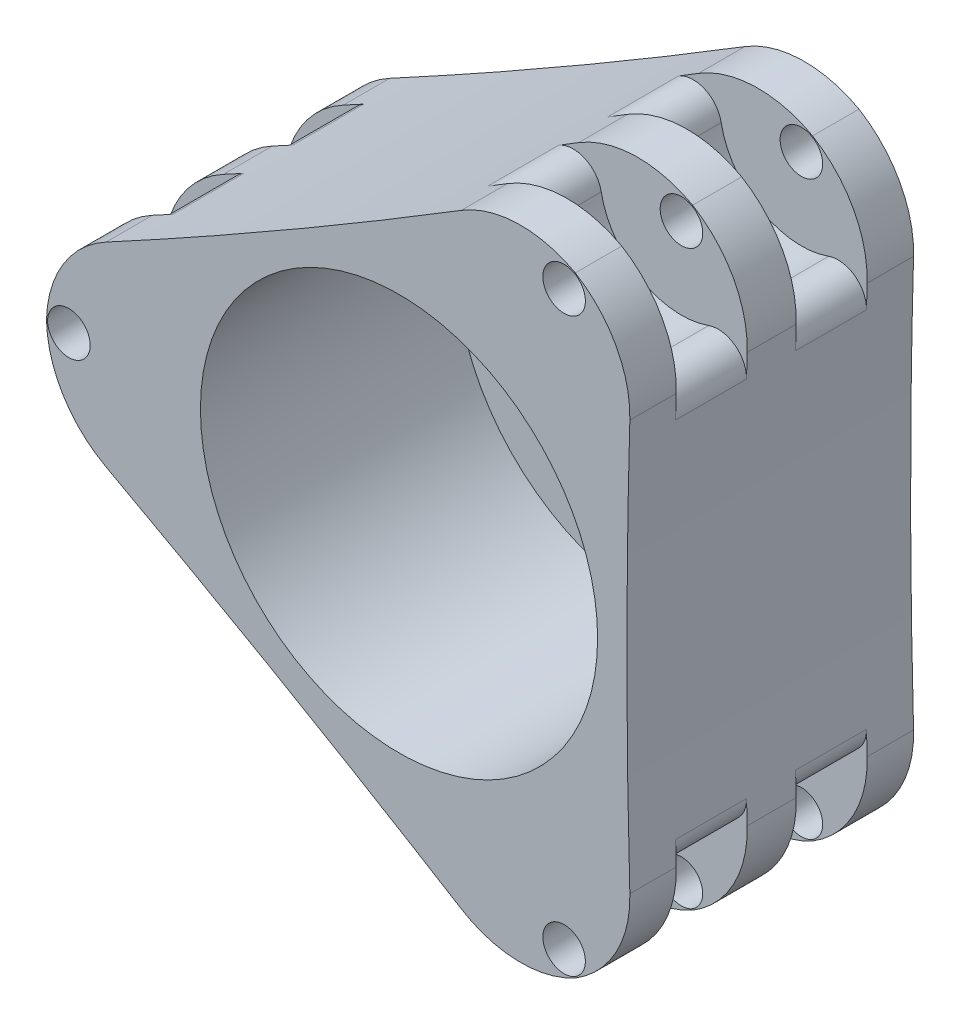
from build123d import *

# Parameters (mm, degrees)
BOSS_EXTRUDE1_DEPTH     = 20
SKETCH4_R               = 14
CUT_EXTRUDE3_DEPTH      = 18
CUT_EXTRUDE4_DEPTH      = 39.683044831
CUT_EXTRUDE4_DEPTH_BACK = 39.683044831
SKETCH5_R               = 5
FILLET2_R               = 8
CIRPATTERN2_DEPTH       = 20
SKETCH2_R               = 1.5
CUT_EXTRUDE1_DEPTH      = 40.044088383
CIRPATTERN10_COUNT      = 3
SKETCH3_R               = 5.75
CUT_EXTRUDE2_DEPTH      = 2.5
CIRPATTERN3_COUNT       = 3
FILLET3_R               = 2
MIRROR1_START           = 11.728432102
MIRROR1_OUTLINE_R       = 1.5
MIRROR1_DEPTH           = 5


# Read off the part's stored shape, not the designer's step: CirPattern2, Mirror1
with BuildPart() as part:
    # Sketch1 → Boss-Extrude1 (new body)
    with BuildSketch(Plane.XY):
        with BuildLine():
            ThreePointArc((-24.374188266, 4.877682355), (-24.857450368, 0), (-24.374188266, -4.877682355))
            add(Edge.make_bspline(
                [(7.962897302, -23.547507412), (-7.857485411, -13.609563951), (-24.374188266, -4.877682355)],
                knots=[0, 0, 0, 1, 1, 1], degree=2))
            ThreePointArc((7.962897302, -23.547507412), (12.428725184, -21.527183492), (16.411290964, -18.669825058))
            add(Edge.make_bspline(
                [(16.411290964, 18.669825058), (15.714970822, 0), (16.411290964, -18.669825058)],
                knots=[0, 0, 0, 1, 1, 1], degree=2))
            ThreePointArc((16.411290964, 18.669825058), (12.428725184, 21.527183492), (7.962897302, 23.547507412))
            add(Edge.make_bspline(
                [(-24.374188266, 4.877682355), (-7.857485411, 13.609563951), (7.962897302, 23.547507412)],
                knots=[0, 0, 0, 1, 1, 1], degree=2))
        make_face()
    extrude(amount=BOSS_EXTRUDE1_DEPTH)

    # Sketch4 → Cut-Extrude3 (cut)
    with BuildSketch(Plane.XY.offset(20)):
        Circle(SKETCH4_R)
    extrude(amount=-CUT_EXTRUDE3_DEPTH, mode=Mode.SUBTRACT)

    # Sketch5 → Cut-Extrude4 (cut, two sides: drawn at the far end of the back side and taken through both)
    with BuildSketch(Plane.XY.offset(2).offset(-CUT_EXTRUDE4_DEPTH_BACK)):
        Circle(SKETCH5_R)
    extrude(amount=CUT_EXTRUDE4_DEPTH + CUT_EXTRUDE4_DEPTH_BACK, mode=Mode.SUBTRACT)

    # Fillet2
    # the kernel refuses this fillet: 8 mm, written as the material it takes off along each edge
    with BuildSketch(Plane(origin=(-24.374188266, -4.877682355, -12.902163969), x_dir=(-0.09337496736268357, 0.9956310137144271, 0), z_dir=(0, 0, 1))) as fillet2_piece_1:
        with BuildLine():
            CenterArc((4.330391744, -7.956777815), FILLET2_R, 84.041434424, 62.254890411)
            ThreePointArc((-2.324956501, -3.517595487), (-1.158780615, -1.761241696), (0, 0))
            ThreePointArc((0, 0), (2.580432794, 0.134299165), (5.160865588, 0))
        make_face()
    extrude(amount=45.804327938, mode=Mode.SUBTRACT)
    with BuildSketch(Plane(origin=(-24.374188266, 4.877682355, -12.902163969), x_dir=(0.8820863080273184, 0.4710878317158435, 0), z_dir=(0, 0, 1))) as fillet2_piece_2:
        with BuildLine():
            CenterArc((4.250145603, -7.999929262), FILLET2_R, 90.240945395, 62.254890411)
            ThreePointArc((-2.845672568, -4.30542463), (-1.534874647, -2.078660503), (0, 0))
            ThreePointArc((0, 0), (2.108251688, -0.004432315), (4.216503379, 0))
        make_face()
    extrude(amount=45.804327938, mode=Mode.SUBTRACT)

    # CirPattern2 outline → CirPattern2 (cut)
    with BuildSketch(Plane.XY):
        with BuildLine():
            add(Edge.make_bspline(
                [(16.411290964, -18.669825058), (16.332703446, -16.562726441), (16.27185489, -14.455627824)],
                knots=[0, 0, 0, 0.112861187, 0.112861187, 0.112861187], degree=2))
            ThreePointArc((16.27185489, -14.455627824), (15.303063117, -18.508724044), (12.427285417, -21.524689742))
            ThreePointArc((12.427285417, -21.524689742), (8.377493655, -22.507203437), (4.383013478, -21.319653613))
            add(Edge.make_bspline(
                [(4.383013478, -21.319653613), (6.17739013, -22.425899317), (7.962897302, -23.547507412)],
                knots=[0.887138813, 0.887138813, 0.887138813, 1, 1, 1], degree=2))
            ThreePointArc((7.962897302, -23.547507412), (12.428725184, -21.527183492), (16.411290964, -18.669825058))
        make_face()
        with BuildLine():
            ThreePointArc((12.427285417, 21.524689742), (15.303063117, 18.508724044), (16.271854889, 14.455627824))
            add(Edge.make_bspline(
                [(16.271854889, 14.455627824), (16.332703446, 16.562726441), (16.411290964, 18.669825058)],
                knots=[0.887138813, 0.887138813, 0.887138813, 1, 1, 1], degree=2))
            ThreePointArc((16.411290964, 18.669825058), (12.428725184, 21.527183492), (7.962897302, 23.547507412))
            add(Edge.make_bspline(
                [(7.962897302, 23.547507412), (6.17739013, 22.425899317), (4.383013478, 21.319653613)],
                knots=[0, 0, 0, 0.112861187, 0.112861187, 0.112861187], degree=2))
            ThreePointArc((4.383013478, 21.319653613), (8.377493655, 22.507203437), (12.427285417, 21.524689742))
        make_face()
    extrude(amount=CIRPATTERN2_DEPTH, mode=Mode.SUBTRACT)

    # Sketch2 → Cut-Extrude1 (cut, symmetric)
    with BuildSketch(Plane.XY.offset(20)):
        with Locations((-23.275, 0)):
            Circle(SKETCH2_R)
    cut_extrude1 = extrude(amount=CUT_EXTRUDE1_DEPTH, both=True, mode=Mode.SUBTRACT)

    # CirPattern10: Cut-Extrude1 ×3 about axis
    cirpattern10_axis = Axis((0, 0, 0), (0, 0, 1))
    for i in range(1, CIRPATTERN10_COUNT):
        add(cut_extrude1.rotate(cirpattern10_axis, i * 360 / CIRPATTERN10_COUNT), mode=Mode.SUBTRACT)

    # Sketch3 → Cut-Extrude2 (cut, symmetric)
    with BuildSketch(Plane.XY.offset(5.771567898)):
        with Locations((-23.275, 0)):
            Circle(SKETCH3_R)
    cut_extrude2 = extrude(amount=CUT_EXTRUDE2_DEPTH, both=True, mode=Mode.SUBTRACT)

    # CirPattern3: Cut-Extrude2 ×3 about axis
    cirpattern3_axis = Axis((0, 0, 0), (0, 0, 1))
    for i in range(1, CIRPATTERN3_COUNT):
        add(cut_extrude2.rotate(cirpattern3_axis, i * 360 / CIRPATTERN3_COUNT), mode=Mode.SUBTRACT)

    # Fillet3
    # the kernel refuses this fillet: 2 mm, written as the material it takes off along each edge
    with BuildSketch(Plane(origin=(6.2485352, -22.162123627, 8.271567898), x_dir=(-0.08658943128363263, 0.9962440817339779, 0), z_dir=(0, 0, -1))) as fillet3_piece_1:
        with BuildLine():
            CenterArc((3.595045079, -1.927780593), FILLET3_R, 105.444191658, 110.988134016)
            Line((1.985927342, -3.115526403), (1.825015568, -3.234300984))
            ThreePointArc((1.825015568, -3.234300984), (0.840321599, -1.904871336), (-0.185539637, -0.074666211))
            Line((-0.185539637, -0.074666211), (0.053259927, 0.192778059))
            ThreePointArc((0.053259927, 0.192778059), (1.531222904, -0.007630794), (3.009185881, 0.192778059))
            Line((3.009185881, 0.192778059), (3.062445808, 0))
        make_face()
    extrude(amount=5, mode=Mode.SUBTRACT)
    with BuildSketch(Plane(origin=(16.068694463, -16.492452033, 8.271567898), x_dir=(-0.8194779675021495, 0.5731106880686713, 0), z_dir=(0, 0, -1))) as fillet3_piece_2:
        with BuildLine():
            CenterArc((3.595045079, 1.927780593), FILLET3_R, 143.567674325, 110.988134016)
            Line((1.985927342, 3.115526403), (1.825015569, 3.234300984))
            ThreePointArc((1.825015569, 3.234300984), (0.840321599, 1.904871335), (-0.185539637, 0.074666211))
            Line((-0.185539637, 0.074666211), (0.053259927, -0.192778059))
            ThreePointArc((0.053259927, -0.192778059), (1.531222904, 0.007630794), (3.009185881, -0.192778059))
            Line((3.009185881, -0.192778059), (3.062445808, 0))
        make_face()
    extrude(amount=5, mode=Mode.SUBTRACT)
    with BuildSketch(Plane(origin=(16.068694462, 16.492452033, 8.271567898), x_dir=(-0.8194779675271912, -0.573110688032865, 0), z_dir=(0, 0, -1))) as fillet3_piece_3:
        with BuildLine():
            CenterArc((3.595045079, -1.927780593), FILLET3_R, 105.444191656, 110.988134016)
            Line((1.985927342, -3.115526403), (1.825015568, -3.234300984))
            ThreePointArc((1.825015568, -3.234300984), (0.840321598, -1.904871335), (-0.185539637, -0.074666211))
            Line((-0.185539637, -0.074666211), (0.053259927, 0.192778059))
            ThreePointArc((0.053259927, 0.192778059), (1.531222904, -0.007630794), (3.009185881, 0.192778059))
            Line((3.009185881, 0.192778059), (3.062445808, 0))
        make_face()
    extrude(amount=5, mode=Mode.SUBTRACT)
    with BuildSketch(Plane(origin=(6.2485352, 22.162123627, 8.271567898), x_dir=(-0.08658943128363542, -0.9962440817339778, 0), z_dir=(0, 0, -1))) as fillet3_piece_4:
        with BuildLine():
            CenterArc((3.595045079, 1.927780593), FILLET3_R, 143.567674326, 110.988134016)
            Line((1.985927342, 3.115526403), (1.825015568, 3.234300984))
            ThreePointArc((1.825015568, 3.234300984), (0.840321599, 1.904871336), (-0.185539637, 0.074666211))
            Line((-0.185539637, 0.074666211), (0.053259927, -0.192778059))
            ThreePointArc((0.053259927, -0.192778059), (1.531222904, 0.007630794), (3.009185881, -0.192778059))
            Line((3.009185881, -0.192778059), (3.062445808, 0))
        make_face()
    extrude(amount=5, mode=Mode.SUBTRACT)
    with BuildSketch(Plane(origin=(-22.317229663, 5.669671594, 8.271567898), x_dir=(0.9060673988031184, -0.4231333936551814, 0), z_dir=(0, 0, -1))) as fillet3_piece_5:
        with BuildLine():
            CenterArc((3.59504508, -1.927780593), FILLET3_R, 105.444191659, 110.988134016)
            Line((1.985927342, -3.115526403), (1.825015569, -3.234300984))
            ThreePointArc((1.825015569, -3.234300984), (0.840321599, -1.904871336), (-0.185539637, -0.074666211))
            Line((-0.185539637, -0.074666211), (0.053259927, 0.192778059))
            ThreePointArc((0.053259927, 0.192778059), (1.531222904, -0.007630794), (3.009185881, 0.192778059))
            Line((3.009185881, 0.192778059), (3.062445809, 0))
        make_face()
    extrude(amount=5, mode=Mode.SUBTRACT)
    with BuildSketch(Plane(origin=(-22.317229663, -5.669671594, 8.271567898), x_dir=(0.9060673988030417, 0.423133393655346, 0), z_dir=(0, 0, -1))) as fillet3_piece_6:
        with BuildLine():
            CenterArc((3.59504508, 1.927780593), FILLET3_R, 143.567674325, 110.988134016)
            Line((1.985927342, 3.115526403), (1.825015569, 3.234300984))
            ThreePointArc((1.825015569, 3.234300984), (0.840321599, 1.904871336), (-0.185539637, 0.074666211))
            Line((-0.185539637, 0.074666211), (0.053259927, -0.192778059))
            ThreePointArc((0.053259927, -0.192778059), (1.531222904, 0.007630794), (3.009185881, -0.192778059))
            Line((3.009185881, -0.192778059), (3.062445809, 0))
        make_face()
    extrude(amount=5, mode=Mode.SUBTRACT)

    # Mirror1 outline → Mirror1 (cut)
    # profile 1 of 3: a face of its own
    with BuildSketch(Plane.XY.offset(MIRROR1_START)):
        with BuildLine():
            ThreePointArc((-19.542447355, -4.373848506), (-17.525, 0), (-19.542447355, 4.373848506))
            ThreePointArc((-19.542447355, 4.373848506), (-20.233318144, 6.103231336), (-19.199562382, 7.652236322))
            add(Edge.make_bspline(
                [(-19.199562382, 7.652236322), (-19.926531874, 7.256947197), (-20.654868368, 6.864025789)],
                knots=[0.842831027, 0.842831027, 0.842831027, 0.887138813, 0.887138813, 0.887138813], degree=2))
            ThreePointArc((-20.654868368, 6.864025789), (-23.680556773, 3.998479393), (-24.854570834, 0))
            ThreePointArc((-24.854570834, 0), (-23.680556773, -3.998479393), (-20.654868368, -6.864025789))
            add(Edge.make_bspline(
                [(-20.654868368, -6.864025789), (-19.926531874, -7.256947197), (-19.199562382, -7.652236322)],
                knots=[0.112861187, 0.112861187, 0.112861187, 0.157168973, 0.157168973, 0.157168973], degree=2))
            ThreePointArc((-19.199562382, -7.652236322), (-20.233318144, -6.103231336), (-19.542447355, -4.373848506))
        make_face()
        with Locations((-23.275, 0)):
            Circle(MIRROR1_OUTLINE_R, mode=Mode.SUBTRACT)
    # profile 2 of 3: a face of its own
    with BuildSketch(Plane.XY.offset(MIRROR1_START)):
        with BuildLine():
            add(Edge.make_bspline(
                [(4.383013478, 21.319653613), (3.67856531, 20.885356411), (2.97275014, 20.453426925)],
                knots=[0.112861187, 0.112861187, 0.112861187, 0.157168973, 0.157168973, 0.157168973], degree=2))
            ThreePointArc((2.97275014, 20.453426925), (4.831105689, 20.574183184), (5.983359759, 19.111180115))
            ThreePointArc((5.983359759, 19.111180115), (8.7625, 15.177095201), (13.559087596, 14.737331609))
            ThreePointArc((13.559087596, 14.737331609), (15.402212454, 14.470951847), (16.226812241, 12.801190603))
            add(Edge.make_bspline(
                [(16.226812241, 12.801190603), (16.247966564, 13.628409213), (16.271854889, 14.455627824)],
                knots=[0.842831027, 0.842831027, 0.842831027, 0.887138813, 0.887138813, 0.887138813], degree=2))
            ThreePointArc((16.271854889, 14.455627824), (15.303063117, 18.508724044), (12.427285417, 21.524689742))
            ThreePointArc((12.427285417, 21.524689742), (8.377493655, 22.507203437), (4.383013478, 21.319653613))
        make_face()
        with Locations((11.6375, 20.156741273)):
            Circle(MIRROR1_OUTLINE_R, mode=Mode.SUBTRACT)
    # profile 3 of 3: a face of its own
    with BuildSketch(Plane.XY.offset(MIRROR1_START)):
        with BuildLine():
            ThreePointArc((5.983359759, -19.111180115), (4.831105689, -20.574183184), (2.97275014, -20.453426925))
            add(Edge.make_bspline(
                [(2.97275014, -20.453426925), (3.67856531, -20.885356411), (4.383013478, -21.319653613)],
                knots=[0.842831027, 0.842831027, 0.842831027, 0.887138813, 0.887138813, 0.887138813], degree=2))
            ThreePointArc((4.383013478, -21.319653613), (8.377493655, -22.507203437), (12.427285417, -21.524689742))
            ThreePointArc((12.427285417, -21.524689742), (15.303063117, -18.508724044), (16.271854889, -14.455627824))
            add(Edge.make_bspline(
                [(16.271854889, -14.455627824), (16.247966564, -13.628409213), (16.226812241, -12.801190603)],
                knots=[0.112861187, 0.112861187, 0.112861187, 0.157168973, 0.157168973, 0.157168973], degree=2))
            ThreePointArc((16.226812241, -12.801190603), (15.402212454, -14.470951847), (13.559087596, -14.737331609))
            ThreePointArc((13.559087596, -14.737331609), (8.7625, -15.177095201), (5.983359759, -19.111180115))
        make_face()
        with Locations((11.6375, -20.156741273)):
            Circle(MIRROR1_OUTLINE_R, mode=Mode.SUBTRACT)
    extrude(amount=MIRROR1_DEPTH, mode=Mode.SUBTRACT)


solid = part.part
